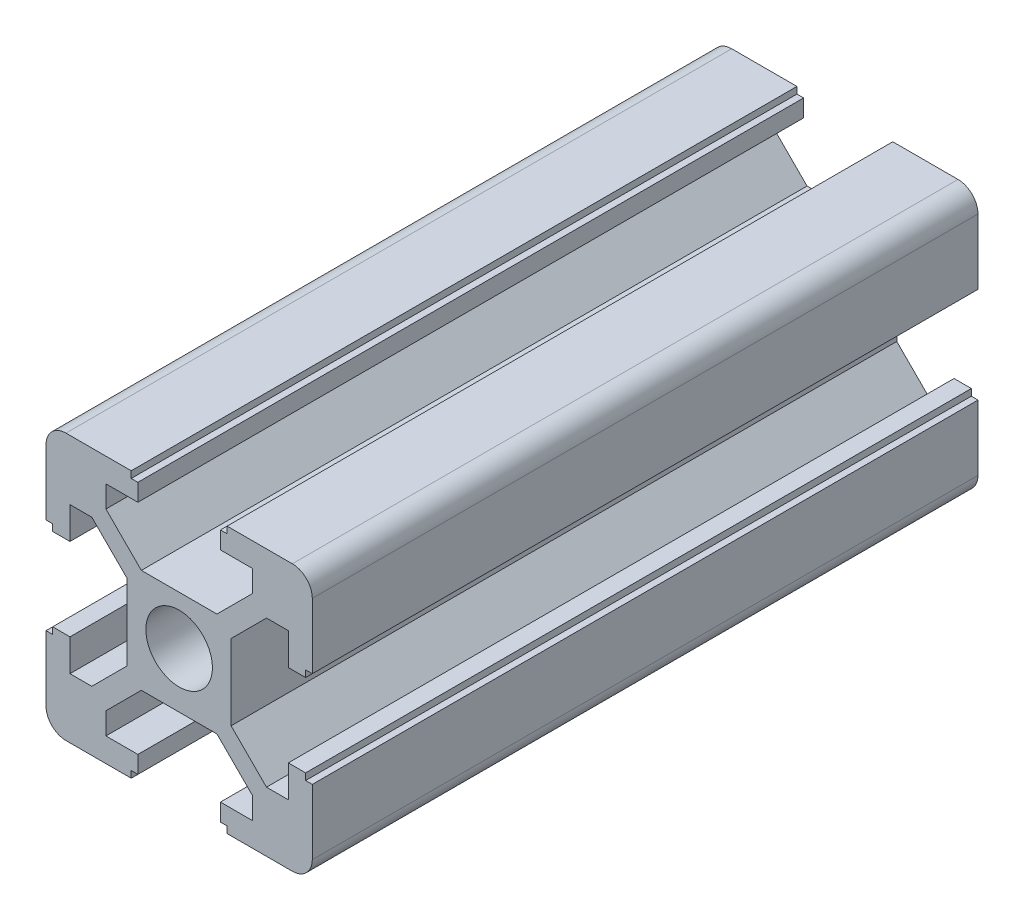
from build123d import *

# Parameters (mm, degrees)
SKETCH1_R           = 2.5
BOSS_EXTRUDE1_DEPTH = 50
SCALE_2_SCALE       = 3
SCALE_3_SCALE       = 6
SCALE_5_SCALE       = 2
SCALE_6_SCALE       = 0.25
SCALE_7_SCALE       = 0.125
SCALE_8_SCALE       = 0.25
SCALE_9_SCALE       = 4
SCALE_10_SCALE      = 4
OTHER_START         = -17.55
OTHER_1_OUTLINE_R   = 5
OTHER_1_DEPTH       = 10


# Read off the part's stored shape, not the designer's step: 孔1
with BuildPart() as part:
    # Sketch1 → Boss-Extrude1 (new body)
    with BuildSketch(Plane.XY):
        with BuildLine():
            Line((2.839339828, 3.9), (5.5, 6.560660172))
            Line((5.5, 6.560660172), (5.5, 8.2))
            Line((5.5, 8.2), (3.1, 8.2))
            Line((3.1, 8.2), (3.1, 9.5))
            Line((3.1, 9.5), (3.6, 9.5))
            Line((3.6, 9.5), (3.6, 10))
            Line((3.6, 10), (8.5, 10))
            ThreePointArc((8.5, 10), (9.560660172, 9.560660172), (10, 8.5))
            Line((10, 8.5), (10, 3.6))
            Line((10, 3.6), (9.5, 3.6))
            Line((9.5, 3.6), (9.5, 3.1))
            Line((9.5, 3.1), (8.2, 3.1))
            Line((8.2, 3.1), (8.2, 5.5))
            Line((8.2, 5.5), (6.560660172, 5.5))
            Line((6.560660172, 5.5), (3.9, 2.839339828))
            Line((3.9, 2.839339828), (3.9, -2.839339828))
            Line((3.9, -2.839339828), (6.560660172, -5.5))
            Line((6.560660172, -5.5), (8.2, -5.5))
            Line((8.2, -5.5), (8.2, -3.1))
            Line((8.2, -3.1), (9.5, -3.1))
            Line((9.5, -3.1), (9.5, -3.6))
            Line((9.5, -3.6), (10, -3.6))
            Line((10, -3.6), (10, -8.5))
            ThreePointArc((10, -8.5), (9.560660172, -9.560660172), (8.5, -10))
            Line((8.5, -10), (3.6, -10))
            Line((3.6, -10), (3.6, -9.5))
            Line((3.6, -9.5), (3.1, -9.5))
            Line((3.1, -9.5), (3.1, -8.2))
            Line((3.1, -8.2), (5.5, -8.2))
            Line((5.5, -8.2), (5.5, -6.560660172))
            Line((5.5, -6.560660172), (2.839339828, -3.9))
            Line((2.839339828, -3.9), (-2.839339828, -3.9))
            Line((-2.839339828, -3.9), (-5.5, -6.560660172))
            Line((-5.5, -6.560660172), (-5.5, -8.2))
            Line((-5.5, -8.2), (-3.1, -8.2))
            Line((-3.1, -8.2), (-3.1, -9.5))
            Line((-3.1, -9.5), (-3.6, -9.5))
            Line((-3.6, -9.5), (-3.6, -10))
            Line((-3.6, -10), (-8.5, -10))
            ThreePointArc((-8.5, -10), (-9.560660172, -9.560660172), (-10, -8.5))
            Line((-10, -8.5), (-10, -3.6))
            Line((-10, -3.6), (-9.5, -3.6))
            Line((-9.5, -3.6), (-9.5, -3.1))
            Line((-9.5, -3.1), (-8.2, -3.1))
            Line((-8.2, -3.1), (-8.2, -5.5))
            Line((-8.2, -5.5), (-6.560660172, -5.5))
            Line((-6.560660172, -5.5), (-3.9, -2.839339828))
            Line((-3.9, -2.839339828), (-3.9, 2.839339828))
            Line((-3.9, 2.839339828), (-6.560660172, 5.5))
            Line((-6.560660172, 5.5), (-8.2, 5.5))
            Line((-8.2, 5.5), (-8.2, 3.1))
            Line((-8.2, 3.1), (-9.5, 3.1))
            Line((-9.5, 3.1), (-9.5, 3.6))
            Line((-9.5, 3.6), (-10, 3.6))
            Line((-10, 3.6), (-10, 8.5))
            ThreePointArc((-10, 8.5), (-9.560660172, 9.560660172), (-8.5, 10))
            Line((-8.5, 10), (-3.6, 10))
            Line((-3.6, 10), (-3.6, 9.5))
            Line((-3.6, 9.5), (-3.1, 9.5))
            Line((-3.1, 9.5), (-3.1, 8.2))
            Line((-3.1, 8.2), (-5.5, 8.2))
            Line((-5.5, 8.2), (-5.5, 6.560660172))
            Line((-5.5, 6.560660172), (-2.839339828, 3.9))
            Line((-2.839339828, 3.9), (2.839339828, 3.9))
        make_face()
        with Locations((0, 0.235847297)):
            Circle(SKETCH1_R, mode=Mode.SUBTRACT)
    extrude(amount=BOSS_EXTRUDE1_DEPTH)


with BuildPart() as part_1:
    # 缩放比例2: scaled about (0, -0.027095247, 25)
    add(part.part.scale(SCALE_2_SCALE).moved(Location((0, 0.054190494, -50))))


with BuildPart() as part_2:
    # 缩放比例3: scaled about (0, -0.027095247, 25)
    add(part_1.part.scale(SCALE_3_SCALE).moved(Location((0, 0.135476235, -125))))


with BuildPart() as part_3:
    # 缩放比例5: scaled about (0, -0.027095249, 25)
    add(part_2.part.scale(SCALE_5_SCALE).moved(Location((0, 0.027095249, -25))))


with BuildPart() as part_4:
    # 缩放比例6: scaled about (0, -0.027095249, 25)
    add(part_3.part.scale(SCALE_6_SCALE).moved(Location((0, -0.020321437, 18.75))))


with BuildPart() as part_5:
    # 缩放比例7: scaled about (0, -0.027095249, 25)
    add(part_4.part.scale(SCALE_7_SCALE).moved(Location((0, -0.023708343, 21.875))))


with BuildPart() as part_6:
    # 缩放比例8: scaled about (0, -0.027095249, 25)
    add(part_5.part.scale(SCALE_8_SCALE).moved(Location((0, -0.020321437, 18.75))))


with BuildPart() as part_7:
    # 缩放比例9: scaled about (0, -0.027095249, 25)
    add(part_6.part.scale(SCALE_9_SCALE).moved(Location((0, 0.081285747, -75))))


with BuildPart() as part_8:
    # 缩放比例10: scaled about (0, -0.027095249, 25)
    add(part_7.part.scale(SCALE_10_SCALE).moved(Location((0, 0.081285747, -75))))

    # 孔1 outline → 孔1 (cut)
    with BuildSketch(Plane.YZ.offset(OTHER_START)):
        with Locations((7.344833538, 1.297306883)):
            Circle(OTHER_1_OUTLINE_R)
    extrude(amount=OTHER_1_DEPTH, mode=Mode.SUBTRACT)


solid = part_8.part
